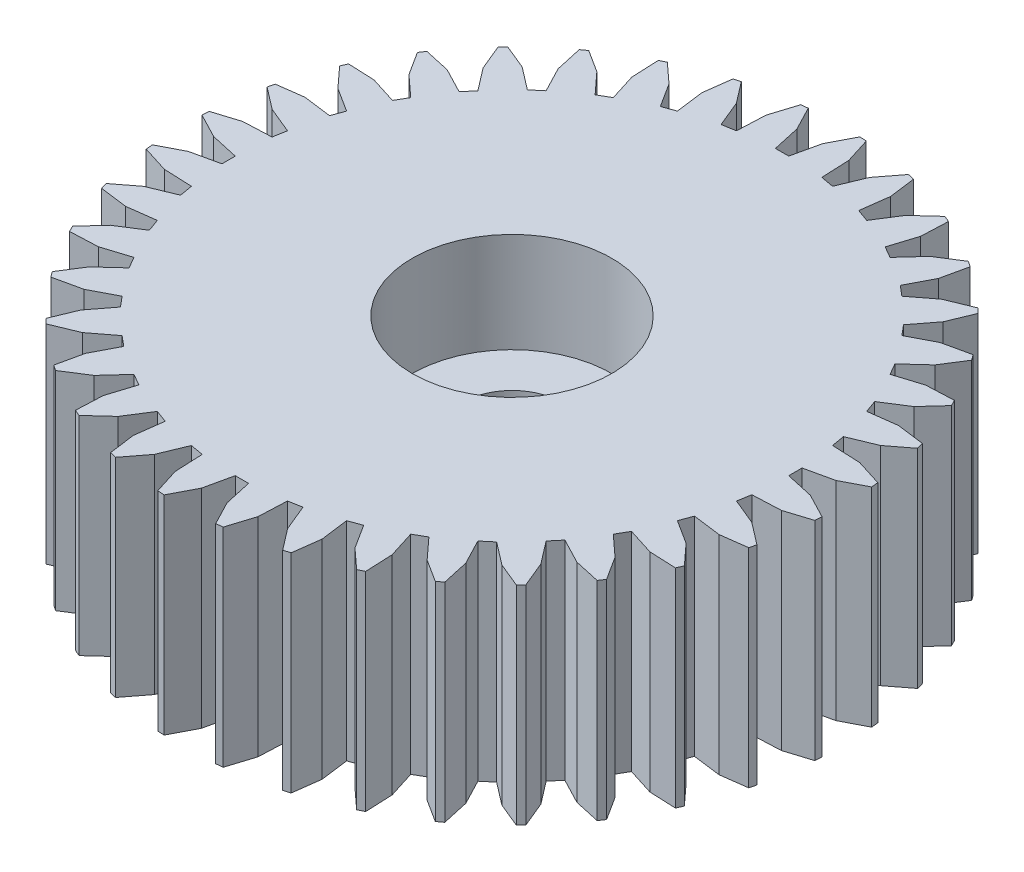
from build123d import *

# Parameters (mm, degrees)
SKETCH1_R           = 10.0584
BOSS_EXTRUDE1_DEPTH = 6.35
SKETCH2_R           = 1.524
CUT_EXTRUDE1_DEPTH  = 16.577718739
SKETCH3_R           = 3.048
CUT_EXTRUDE2_DEPTH  = 3.048
CUT_EXTRUDE3_DEPTH  = 16.577718739
CIRPATTERN1_COUNT   = 36


with BuildPart() as part:
    # Sketch1 → Boss-Extrude1 (new body)
    with BuildSketch(Plane(origin=(0, 0, 0), x_dir=(1, 0, 0), z_dir=(0, 1, 0))):
        Circle(SKETCH1_R)
    extrude(amount=BOSS_EXTRUDE1_DEPTH)

    # Sketch2 → Cut-Extrude1 (cut, through all)
    with BuildSketch(Plane(origin=(0, 6.35, 0), x_dir=(1, 0, 0), z_dir=(0, 1, 0))):
        Circle(SKETCH2_R)
    extrude(amount=-CUT_EXTRUDE1_DEPTH, mode=Mode.SUBTRACT)

    # Sketch3 → Cut-Extrude2 (cut)
    with BuildSketch(Plane(origin=(0, 6.35, 0), x_dir=(1, 0, 0), z_dir=(0, 1, 0))):
        Circle(SKETCH3_R)
    extrude(amount=-CUT_EXTRUDE2_DEPTH, mode=Mode.SUBTRACT)

    # Sketch4 → Cut-Extrude3 (cut, through all)
    with BuildSketch(Plane.XZ):
        Polygon((-26.806716732, -59.6465888), (-0.992739546, -10.0584), (-0.593526671, -9.291519201), (-0.4064, -8.447445337), (0, -8.447445337), (0.187126671, -9.291519201), (0.586339546, -10.0584), (26.400316732, -59.6465888), (26.400316732, -171.456246463), (-26.806716732, -171.456246463), align=None)
    cut_extrude3 = extrude(amount=-CUT_EXTRUDE3_DEPTH, mode=Mode.SUBTRACT)

    # CirPattern1: Cut-Extrude3 ×36 about axis
    cirpattern1_axis = Axis((0, 0, 0), (0, 1, 0))
    for i in range(1, CIRPATTERN1_COUNT):
        add(cut_extrude3.rotate(cirpattern1_axis, i * 360 / CIRPATTERN1_COUNT), mode=Mode.SUBTRACT)


solid = part.part
